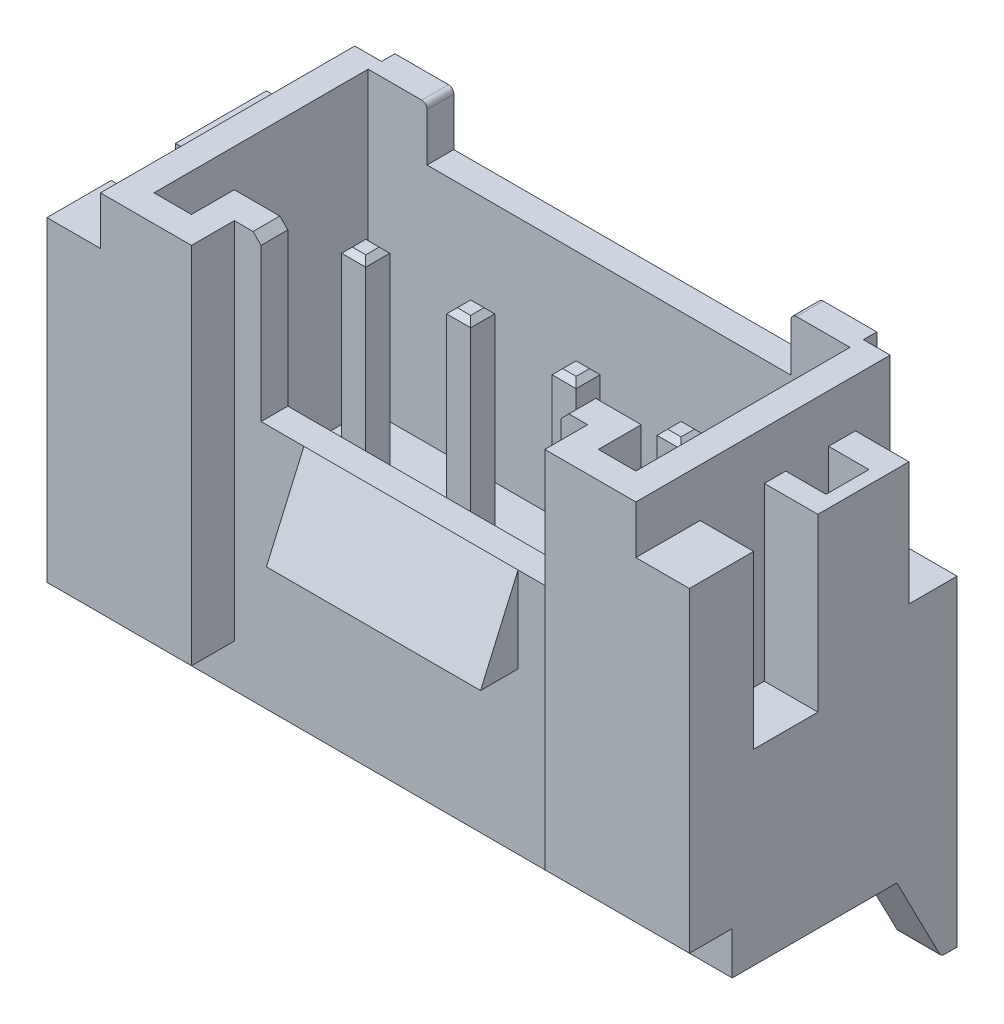
from build123d import *

# Parameters (mm, degrees)
ESQUISSE1_W                  = 10
ESQUISSE1_H                  = 5
BOSS_EXTRU_1_DEPTH           = 7.6
ESQUISSE2_W                  = 6.6
ESQUISSE2_H                  = 0.8
ENL_V_MAT_EXTRU_1_DEPTH      = 8
ENL_V_MAT_EXTRU_2_DEPTH      = 5.5
ESQUISSE5_W                  = 6.8
ESQUISSE5_H                  = 0.5
ENL_V_MAT_EXTRU_3_DEPTH      = 1
ESQUISSE6_W                  = 5.6
ESQUISSE6_H                  = 0.5
ENL_V_MAT_EXTRU_4_DEPTH      = 3
ESQUISSE8_W                  = 6.6
ESQUISSE8_H                  = 4.2
ENL_V_MAT_EXTRU_6_DEPTH      = 0.9
BOSS_EXTRU_2_DEPTH           = 6.8
BOSS_EXTRU_3_DEPTH           = 2
BOSS_EXTRU_3_DEPTH_BACK      = 2
ESQUISSE17_W                 = 1.25
ESQUISSE17_H                 = 4.2
BOSS_EXTRU_8_DEPTH           = 1
CHANFREIN1_SIZE              = 0.15
BOSS_EXTRU_5_DEPTH           = 0.45
BOSS_EXTRU_5_DEPTH_BACK      = 6.3
ESQUISSE13_W                 = 0.45
ESQUISSE13_H                 = 0.45
ESQUISSE18_W                 = 0.71
ESQUISSE18_H                 = 0.393329106
ESQUISSE18_W_2               = 0.715
BOSS_EXTRU_9_DEPTH           = 0.9
CHANFREIN2_SIZE              = 0.1
ESQUISSE14_W                 = 0.45
ESQUISSE14_H                 = 0.43
BOSS_EXTRU_6_DEPTH           = 1.875
CONG_1_R                     = 0.1
CONG_2_R                     = 0.1
ESQUISSE21_W                 = 1
ESQUISSE21_H                 = 5
BOSS_EXTRU_10_DEPTH          = 6.7
ESQUISSE22_W                 = 0.8
ESQUISSE22_H                 = 0.8
ENL_V_MAT_EXTRU_8_DEPTH      = 12
ENL_V_MAT_EXTRU_9_DEPTH      = 0.9
ENL_V_MAT_EXTRU_9_DEPTH_BACK = 2.3
ESQUISSE23_W                 = 0.752542273
ESQUISSE23_H                 = 0.8
ESQUISSE24_W                 = 1
ESQUISSE24_H                 = 1.2
ENL_V_MAT_EXTRU_10_DEPTH     = 3.2
ESQUISSE25_W                 = 0.45
ESQUISSE25_H                 = 0.45
BOSS_EXTRU_11_DEPTH          = 1.9
CONG_3_R                     = 0.1
CONG_4_R                     = 0.2
BOSS_EXTRU_12_DEPTH          = 0.8
BOSS_EXTRU_13_START          = -0.8
BOSS_EXTRU_13_DEPTH          = 0.8


with BuildPart() as part:
    # Esquisse1 → Boss.-Extru.1 (new body)
    with BuildSketch(Plane(origin=(0, 0, 0), x_dir=(1, 0, 0), z_dir=(0, 1, 0))):
        with Locations((5, 2.5)):
            Rectangle(ESQUISSE1_W, ESQUISSE1_H)
    extrude(amount=BOSS_EXTRU_1_DEPTH)

    # Esquisse2 → Enlèv. mat.-Extru.1 (cut)
    with BuildSketch(Plane(origin=(0, 7.6, 0), x_dir=(1, 0, 0), z_dir=(0, 1, 0))):
        with Locations((5, 0.4)):
            Rectangle(ESQUISSE2_W, ESQUISSE2_H)
    extrude(amount=-ENL_V_MAT_EXTRU_1_DEPTH, mode=Mode.SUBTRACT)

    # Esquisse4 → Enlèv. mat.-Extru.2 (cut)
    with BuildSketch(Plane(origin=(0, 7.6, 0), x_dir=(1, 0, 0), z_dir=(0, 1, 0))):
        Polygon((0.5, 0.5), (1.2, 0.5), (1.2, 1.3), (8.8, 1.3), (8.8, 0.5), (9.5, 0.5), (9.5, 4.5), (0.5, 4.5), align=None)
    extrude(amount=-ENL_V_MAT_EXTRU_2_DEPTH, mode=Mode.SUBTRACT)

    # Esquisse5 → Enlèv. mat.-Extru.3 (cut)
    with BuildSketch(Plane(origin=(0, 7.6, 0), x_dir=(1, 0, 0), z_dir=(0, 1, 0))):
        with Locations((5, 4.75)):
            Rectangle(ESQUISSE5_W, ESQUISSE5_H)
    extrude(amount=-ENL_V_MAT_EXTRU_3_DEPTH, mode=Mode.SUBTRACT)

    # Esquisse6 → Enlèv. mat.-Extru.4 (cut)
    with BuildSketch(Plane(origin=(0, 7.6, 0), x_dir=(1, 0, 0), z_dir=(0, 1, 0))):
        with Locations((5, 1.05)):
            Rectangle(ESQUISSE6_W, ESQUISSE6_H)
    extrude(amount=-ENL_V_MAT_EXTRU_4_DEPTH, mode=Mode.SUBTRACT)

    # Esquisse8 → Enlèv. mat.-Extru.6 (cut)
    with BuildSketch(Plane.XZ):
        with Locations((5, -2.9)):
            Rectangle(ESQUISSE8_W, ESQUISSE8_H)
    extrude(amount=-ENL_V_MAT_EXTRU_6_DEPTH, mode=Mode.SUBTRACT)

    # Esquisse9 → Boss.-Extru.2 (add)
    with BuildSketch(Plane(origin=(1.7, 0, 0), x_dir=(0, 0, -1), z_dir=(1, 0, 0))):
        Polygon((4.710085046, 0.977131832), (3.4, 0), (2.4, 0), (1.089914954, 0.977131832), align=None)
    extrude(amount=BOSS_EXTRU_2_DEPTH)

    # Esquisse11 → Boss.-Extru.3 (add, two sides: drawn at the far end of the back side and taken through both)
    with BuildSketch(Plane(origin=(5, 0, 0), x_dir=(0, 0, -1), z_dir=(1, 0, 0)).offset(-BOSS_EXTRU_3_DEPTH_BACK)):
        Polygon((0.8, 4.6), (0.1, 3), (0.8, 3), align=None)
    extrude(amount=BOSS_EXTRU_3_DEPTH + BOSS_EXTRU_3_DEPTH_BACK)

    # Esquisse17 → Boss.-Extru.8 (add)
    with BuildSketch(Plane(origin=(0, 1, 0), x_dir=(1, 0, 0), z_dir=(0, 1, 0))):
        with Locations((3.035, 2.9)):
            Rectangle(ESQUISSE17_W, ESQUISSE17_H)
        with Locations((5, 2.9)):
            Rectangle(ESQUISSE17_W, ESQUISSE17_H)
        with Locations((6.965, 2.9)):
            Rectangle(ESQUISSE17_W, ESQUISSE17_H)
    extrude(amount=-BOSS_EXTRU_8_DEPTH)

    # Chanfrein1
    chanfrein1_edges = [part.edges().sort_by_distance(p)[0] for p in [
        (2.2, 7.6, -1.05),
        (7.8, 7.6, -1.05),
    ]]
    chamfer(chanfrein1_edges, length=CHANFREIN1_SIZE)

    # Esquisse13 → Boss.-Extru.5 (add, two sides: drawn at the far end of the back side and taken through both)
    with BuildSketch(Plane.XZ.offset(-BOSS_EXTRU_5_DEPTH_BACK)):
        with Locations((2.055, -2.9)):
            Rectangle(ESQUISSE13_W, ESQUISSE13_H)
        with Locations((4.015, -2.9)):
            Rectangle(ESQUISSE13_W, ESQUISSE13_H)
        with Locations((5.985, -2.9)):
            Rectangle(ESQUISSE13_W, ESQUISSE13_H)
        with Locations((7.945, -2.9)):
            Rectangle(ESQUISSE13_W, ESQUISSE13_H)
    extrude(amount=BOSS_EXTRU_5_DEPTH + BOSS_EXTRU_5_DEPTH_BACK)

    # Esquisse18 → Boss.-Extru.9 (add)
    with BuildSketch(Plane.XZ.offset(-0.9)):
        with Locations((2.055, -0.996664553)):
            Rectangle(ESQUISSE18_W, ESQUISSE18_H)
        with Locations((4.0175, -0.996664553)):
            Rectangle(ESQUISSE18_W_2, ESQUISSE18_H)
        with Locations((5.9825, -0.996664553)):
            Rectangle(ESQUISSE18_W_2, ESQUISSE18_H)
        with Locations((7.945, -0.996664553)):
            Rectangle(ESQUISSE18_W, ESQUISSE18_H)
    extrude(amount=BOSS_EXTRU_9_DEPTH)

    # Chanfrein2
    chanfrein2_edges = [part.edges().sort_by_distance(p)[0] for p in [
        (1.83, 6.3, -2.9),
        (2.055, 6.3, -2.675),
        (2.28, 6.3, -2.9),
        (2.055, 6.3, -3.125),
        (4.24, 6.3, -2.9),
        (4.015, 6.3, -3.125),
        (3.79, 6.3, -2.9),
        (4.015, 6.3, -2.675),
        (5.76, 6.3, -2.9),
        (5.985, 6.3, -2.675),
        (6.21, 6.3, -2.9),
        (5.985, 6.3, -3.125),
        (7.945, 6.3, -2.675),
        (8.17, 6.3, -2.9),
        (7.945, 6.3, -3.125),
        (7.72, 6.3, -2.9),
    ]]
    chamfer(chanfrein2_edges, length=CHANFREIN2_SIZE)

    # Esquisse14 → Boss.-Extru.6 (add)
    with BuildSketch(Plane(origin=(0, 0, -3.125), x_dir=(-1, 0, 0), z_dir=(0, 0, -1))):
        with Locations((-7.945, -0.235)):
            Rectangle(ESQUISSE14_W, ESQUISSE14_H)
        with Locations((-5.985, -0.235)):
            Rectangle(ESQUISSE14_W, ESQUISSE14_H)
        with Locations((-4.015, -0.235)):
            Rectangle(ESQUISSE14_W, ESQUISSE14_H)
        with Locations((-2.055, -0.235)):
            Rectangle(ESQUISSE14_W, ESQUISSE14_H)
    extrude(amount=BOSS_EXTRU_6_DEPTH)

    # Congé1
    # the kernel refuses this fillet: 0.1 mm, written as the material it adds along each edge
    with BuildSketch(Plane(origin=(7.72, -0.02, -3.125), x_dir=(0, 0, -1), z_dir=(1, 0, 0)), Plane(origin=(3.79, -0.02, -3.125), x_dir=(0, 0, -1), z_dir=(1, 0, 0))) as cong_1_piece_1:
        with BuildLine():
            CenterArc((0.06, 0.1), CONG_1_R, 233.130102354, 36.869897646)
            Line((0, 0.02), (0, 0))
            Line((0, 0), (0.06, 0))
        make_face()
    extrude(amount=0.45)
    with BuildSketch(Plane(origin=(6.21, -0.02, -3.125), x_dir=(0, 0, -1), z_dir=(-1, 0, 0)), Plane(origin=(2.28, -0.02, -3.125), x_dir=(0, 0, -1), z_dir=(-1, 0, 0))) as cong_1_piece_2:
        with BuildLine():
            CenterArc((0.06, -0.1), CONG_1_R, 90, 36.869897646)
            Line((0, -0.02), (0, 0))
            Line((0, 0), (0.06, 0))
        make_face()
    extrude(amount=0.45)
    # the kernel refuses this fillet: 0.1 mm, written as the material it takes off along each edge
    with BuildSketch(Plane(origin=(1.58, -0.45, -2.675), x_dir=(0, 1, 0), z_dir=(1, 0, 0)), Plane(origin=(3.54, -0.45, -2.675), x_dir=(0, 1, 0), z_dir=(1, 0, 0))) as cong_1_2_piece_1:
        with BuildLine():
            CenterArc((CONG_1_R, -CONG_1_R), CONG_1_R, 90, 90)
            Line((0, -CONG_1_R), (0, 0))
            Line((0, 0), (CONG_1_R, 0))
        make_face()
    extrude(amount=0.95, mode=Mode.SUBTRACT)
    with BuildSketch(Plane(origin=(6.46, -0.45, -2.675), x_dir=(0, 1, 0), z_dir=(-1, 0, 0)), Plane(origin=(8.42, -0.45, -2.675), x_dir=(0, 1, 0), z_dir=(-1, 0, 0))) as cong_1_2_piece_2:
        with BuildLine():
            CenterArc((CONG_1_R, CONG_1_R), CONG_1_R, 180, 90)
            Line((0, CONG_1_R), (0, 0))
            Line((0, 0), (CONG_1_R, 0))
        make_face()
    extrude(amount=0.95, mode=Mode.SUBTRACT)

    # Congé2
    cong_2_edges = [part.edges().sort_by_distance(p)[0] for p in [
        (1.6, 7.6, -4.75),
        (8.4, 7.6, -4.75),
    ]]
    fillet(cong_2_edges, radius=CONG_2_R)

    # Esquisse21 → Boss.-Extru.10 (add)
    with BuildSketch(Plane(origin=(0, 6.7, 0), x_dir=(1, 0, 0), z_dir=(0, 1, 0))):
        with Locations((-0.5, 2.5)):
            Rectangle(ESQUISSE21_W, ESQUISSE21_H)
        with Locations((10.5, 2.5)):
            Rectangle(ESQUISSE21_W, ESQUISSE21_H)
    extrude(amount=-BOSS_EXTRU_10_DEPTH)

    # Esquisse22 → Enlèv. mat.-Extru.8 (cut)
    with BuildSketch(Plane(origin=(11, 0, 0), x_dir=(0, 0, -1), z_dir=(1, 0, 0))):
        with Locations((0.4, 0.4)):
            Rectangle(ESQUISSE22_W, ESQUISSE22_H)
    extrude(amount=-ENL_V_MAT_EXTRU_8_DEPTH, mode=Mode.SUBTRACT)

    # Esquisse23 → Enlèv. mat.-Extru.9 (cut, two sides: drawn at the far end of the back side and taken through both)
    with BuildSketch(Plane(origin=(0, 6.7, 0), x_dir=(1, 0, 0), z_dir=(0, 1, 0)).offset(-ENL_V_MAT_EXTRU_9_DEPTH_BACK)):
        Polygon((11, 5), (10, 5), (9.5, 5), (9.5, 4.75), (10, 4.75), (10, 4.1), (11, 4.1), align=None)
        with Locations((10.376271137, 3.2)):
            Rectangle(ESQUISSE23_W, ESQUISSE23_H)
        with Locations((-0.376271137, 3.2)):
            Rectangle(ESQUISSE23_W, ESQUISSE23_H)
        Polygon((0, 4.75), (0, 4.1), (-1, 4.1), (-1, 5), (0, 5), (0.5, 5), (0.5, 4.75), align=None)
    extrude(amount=ENL_V_MAT_EXTRU_9_DEPTH + ENL_V_MAT_EXTRU_9_DEPTH_BACK, mode=Mode.SUBTRACT)

    # Esquisse24 → Enlèv. mat.-Extru.10 (cut)
    with BuildSketch(Plane(origin=(0, 6.7, 0), x_dir=(1, 0, 0), z_dir=(0, 1, 0))):
        with Locations((10.5, 1.8)):
            Rectangle(ESQUISSE24_W, ESQUISSE24_H)
        with Locations((-0.5, 1.8)):
            Rectangle(ESQUISSE24_W, ESQUISSE24_H)
    extrude(amount=-ENL_V_MAT_EXTRU_10_DEPTH, mode=Mode.SUBTRACT)

    # Esquisse25 → Boss.-Extru.11 (add)
    with BuildSketch(Plane.XZ.offset(0.45)):
        with Locations((2.055, -4.775)):
            Rectangle(ESQUISSE25_W, ESQUISSE25_H)
        with Locations((4.015, -4.775)):
            Rectangle(ESQUISSE25_W, ESQUISSE25_H)
        with Locations((5.985, -4.775)):
            Rectangle(ESQUISSE25_W, ESQUISSE25_H)
        with Locations((7.945, -4.775)):
            Rectangle(ESQUISSE25_W, ESQUISSE25_H)
    extrude(amount=BOSS_EXTRU_11_DEPTH)

    # Congé3
    cong_3_edges = [part.edges().sort_by_distance(p)[0] for p in [
        (7.945, -0.02, -5),
        (5.985, -0.02, -5),
        (4.015, -0.02, -5),
        (2.055, -0.02, -5),
        (2.055, -0.45, -4.55),
        (4.015, -0.45, -4.55),
        (5.985, -0.45, -4.55),
        (7.945, -0.45, -4.55),
    ]]
    fillet(cong_3_edges, radius=CONG_3_R)

    # Congé4
    cong_4_edges = [part.edges().sort_by_distance(p)[0] for p in [
        (2.055, -2.35, -4.55),
        (4.015, -2.35, -4.55),
        (5.985, -2.35, -4.55),
        (7.945, -2.35, -4.55),
    ]]
    fillet(cong_4_edges, radius=CONG_4_R)

    # Esquisse27 → Boss.-Extru.12 (add)
    with BuildSketch(Plane.ZY.offset(1)):
        with BuildLine():
            Line((-5, 0), (-5, -1.6))
            Line((-5, -1.6), (-4.76096118, -1.6))
            ThreePointArc((-4.76096118, -1.6), (-4.708909419, -1.585385094), (-4.672072291, -1.545812285))
            Line((-4.672072291, -1.545812285), (-3.875378875, 0))
            Line((-3.875378875, 0), (-5, 0))
        make_face()
    extrude(amount=-BOSS_EXTRU_12_DEPTH)

    # Esquisse28 → Boss.-Extru.13 (add)
    with BuildSketch(Plane(origin=(11, 0, 0), x_dir=(0, 0, -1), z_dir=(1, 0, 0)).offset(BOSS_EXTRU_13_START)):
        with BuildLine():
            Line((5, -1.6), (5, 0))
            Line((5, 0), (3.875378875, 0))
            Line((3.875378875, 0), (4.672072291, -1.545812285))
            ThreePointArc((4.672072291, -1.545812285), (4.708909419, -1.585385094), (4.76096118, -1.6))
            Line((4.76096118, -1.6), (5, -1.6))
        make_face()
    extrude(amount=BOSS_EXTRU_13_DEPTH)


solid = part.part
